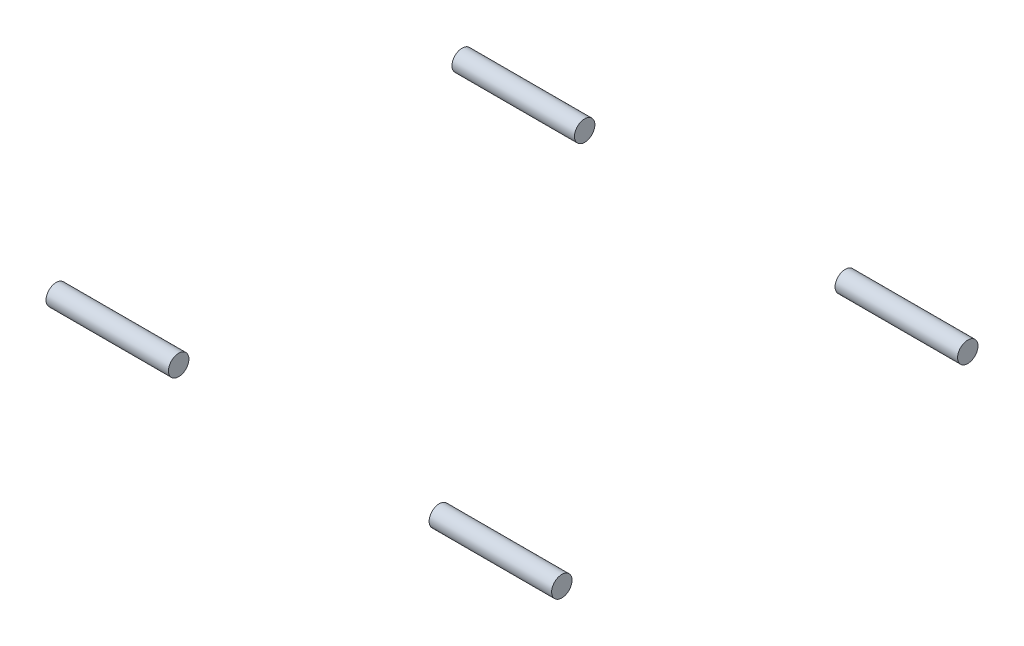
from build123d import *

# Parameters (mm, degrees)
SKETCH1_R             = 3.175
BOSS_EXTRUDE1_DEPTH   = 38.1
BOSS_EXTRUDE1_2_DEPTH = 38.1


with BuildPart() as part:
    # Sketch1 → Boss-Extrude1 (new body)
    with BuildSketch(Plane.ZY.offset(-78.625)):
        with Locations((126.249998656, 0)):
            Circle(SKETCH1_R)
    extrude(amount=BOSS_EXTRUDE1_DEPTH)


with BuildPart() as body_2:
    # Sketch1 → Boss-Extrude1 2 (new body)
    with BuildSketch(Plane.ZY.offset(-78.625)):
        Circle(SKETCH1_R)
    extrude(amount=BOSS_EXTRUDE1_2_DEPTH)


with BuildPart() as body_3:
    # Mirror1: mirrored copy
    add(part.part.mirror(Plane(origin=(0, 0, 0), x_dir=(0, 0, 1), z_dir=(1, 0, 0))))


with BuildPart() as body_4:
    # Mirror1 2: mirrored copy
    add(body_2.part.mirror(Plane(origin=(0, 0, 0), x_dir=(0, 0, 1), z_dir=(1, 0, 0))))


solid = Compound([part.part, body_2.part, body_3.part, body_4.part])
